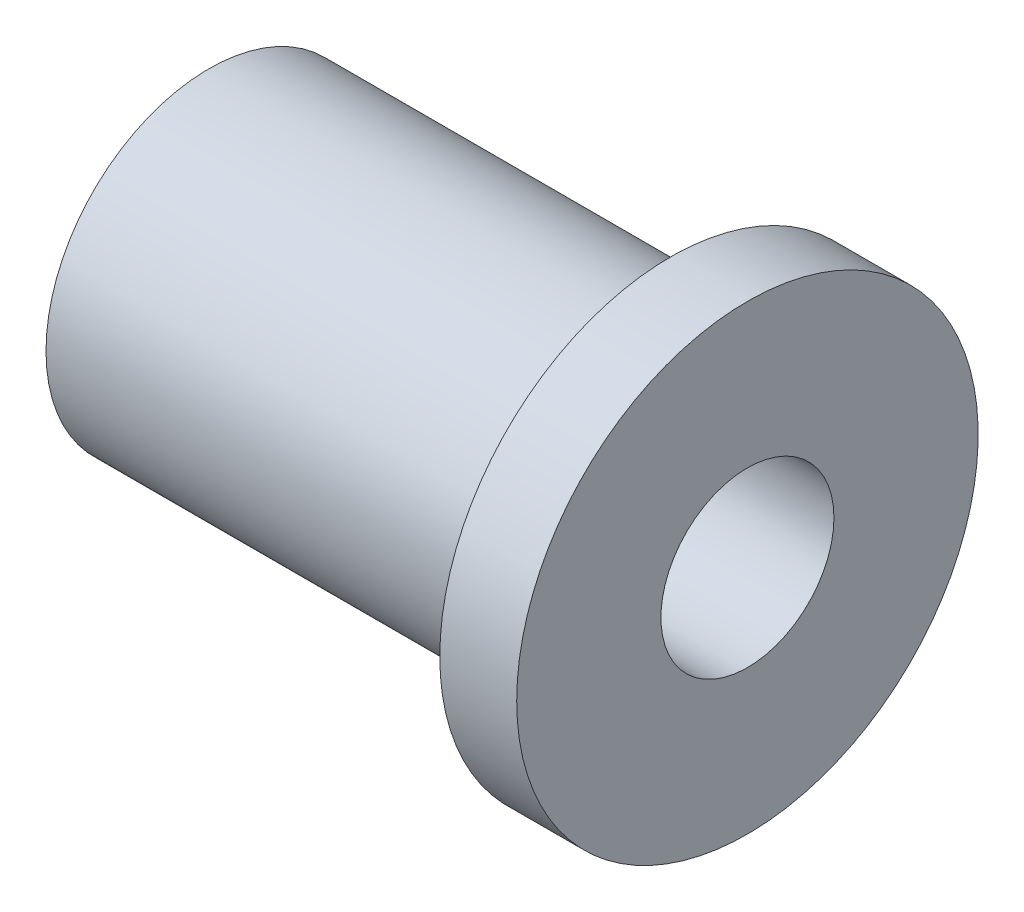
from build123d import *

# Parameters (mm, degrees)
F_9_32_0_28125_DIAMETER_HOLE1_D   = 7.14375
PIPE_TAP_DRILL_FOR_1_8_TAP2_D     = 8.4328
PIPE_TAP_DRILL_FOR_1_8_TAP2_DEPTH = 12.7
PIPE_TAP_DRILL_FOR_1_8_TAP2_TIP   = 2.533468714


with BuildPart() as part:
    # Sketch1 → Revolve1 (revolve)
    with BuildSketch(Plane.XY):
        Polygon((0, 0), (0, 6.731), (19.05, 6.731), (19.05, 9.525), (22.225, 9.525), (22.225, 0), align=None)
    revolve(axis=Axis((0, 0, 0), (1, 0, 0)))

    # 9/32 (0.28125) Diameter Hole1 (through all)
    with Locations(Plane(origin=(22.225, 0, 0), x_dir=(0, 0, -1), z_dir=(1, 0, 0))):
        with Locations((0, 0)):
            Hole(F_9_32_0_28125_DIAMETER_HOLE1_D / 2)

    # Pipe Tap Drill for 1/8 Tap2
    with Locations(Plane.ZY):
        with Locations((0, 0)):
            Hole(PIPE_TAP_DRILL_FOR_1_8_TAP2_D / 2, depth=PIPE_TAP_DRILL_FOR_1_8_TAP2_DEPTH)
            with Locations((0, 0, -(PIPE_TAP_DRILL_FOR_1_8_TAP2_DEPTH + PIPE_TAP_DRILL_FOR_1_8_TAP2_TIP / 2))):  # 118° drill point
                Cone(0, PIPE_TAP_DRILL_FOR_1_8_TAP2_D / 2, PIPE_TAP_DRILL_FOR_1_8_TAP2_TIP, mode=Mode.SUBTRACT)


solid = part.part
